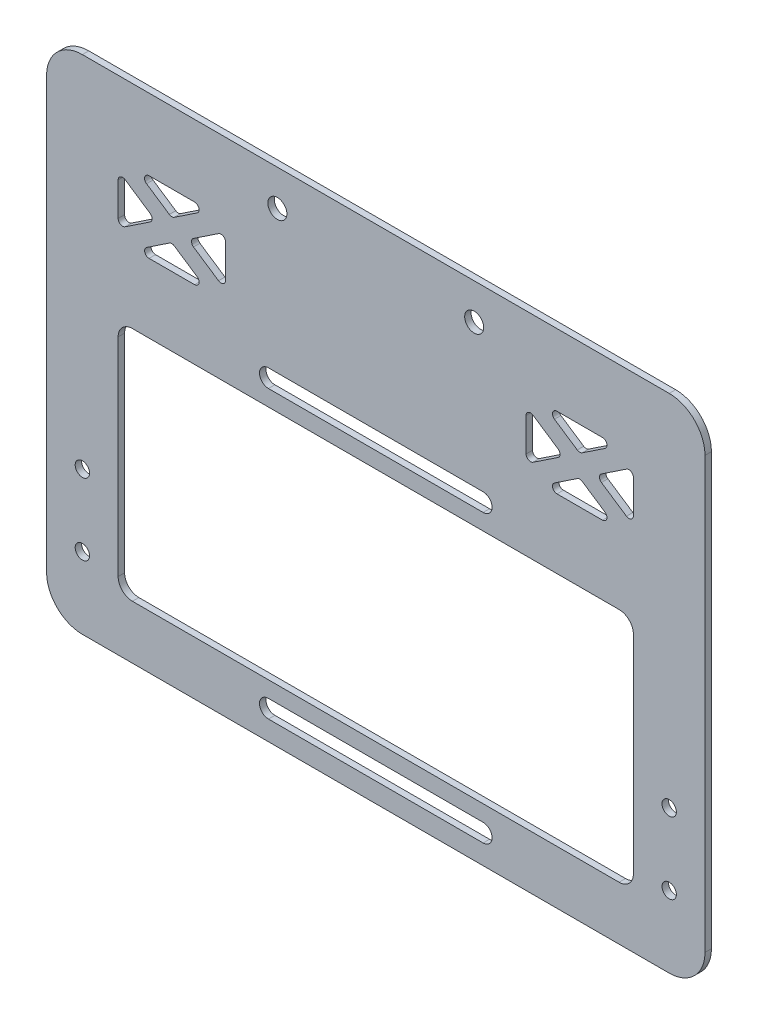
from build123d import *

# Parameters (mm, degrees)
SKETCH1_W               = 233.68
SKETCH1_H               = 178.200406036
BOSS_EXTRUDE1_DEPTH     = 2.286
CUT_EXTRUDE1_DEPTH      = 147.95461059
F_1_4_CLEARANCE_HOLE2_D = 6.7564
FILLET1_R               = 12.7
SKETCH9_R               = 2.5527
CUT_EXTRUDE2_DEPTH      = 147.95461059
CUT_EXTRUDE3_DEPTH      = 147.95461059
FILLET2_R               = 1.5875


with BuildPart() as part:
    # Sketch1 → Boss-Extrude1 (new body)
    with BuildSketch(Plane.XY):
        Rectangle(SKETCH1_W, SKETCH1_H)
        with BuildLine():
            Line((-86.36, 13.769796982), (86.36, 13.769796982))
            ThreePointArc((86.36, 13.769796982), (89.952102448, 12.281899431), (91.44, 8.689796982))
            Line((91.44, 8.689796982), (91.44, -64.970203018))
            ThreePointArc((91.44, -64.970203018), (89.952102448, -68.562305466), (86.36, -70.050203018))
            Line((86.36, -70.050203018), (-86.36, -70.050203018))
            ThreePointArc((-86.36, -70.050203018), (-89.952102448, -68.562305466), (-91.44, -64.970203018))
            Line((-91.44, -64.970203018), (-91.44, 8.689796982))
            ThreePointArc((-91.44, 8.689796982), (-89.952102448, 12.281899431), (-86.36, 13.769796982))
        make_face(mode=Mode.SUBTRACT)
    extrude(amount=BOSS_EXTRUDE1_DEPTH)

    # Sketch2 → Cut-Extrude1 (cut, through all)
    with BuildSketch(Plane.XY.offset(2.286)):
        with BuildLine():
            Line((38.1, 19.484796982), (-38.1, 19.484796982))
            ThreePointArc((-38.1, 19.484796982), (-41.275, 22.659796982), (-38.1, 25.834796982))
            Line((-38.1, 25.834796982), (38.1, 25.834796982))
            ThreePointArc((38.1, 25.834796982), (41.275, 22.659796982), (38.1, 19.484796982))
        make_face()
        with BuildLine():
            Line((38.1, -75.765203018), (-38.1, -75.765203018))
            ThreePointArc((-38.1, -75.765203018), (-41.275, -78.940203018), (-38.1, -82.115203018))
            Line((-38.1, -82.115203018), (38.1, -82.115203018))
            ThreePointArc((38.1, -82.115203018), (41.275, -78.940203018), (38.1, -75.765203018))
        make_face()
    extrude(amount=-CUT_EXTRUDE1_DEPTH, mode=Mode.SUBTRACT)

    # 1/4 Clearance Hole2 (through all)
    with Locations(Plane.XY.offset(2.286)):
        with Locations((-34.925, 76.400203018), (34.925, 76.400203018)):
            Hole(F_1_4_CLEARANCE_HOLE2_D / 2)

    # Fillet1
    fillet1_edges = [part.edges().sort_by_distance(p)[0] for p in [
        (-116.84, 89.100203018, 1.143),
        (116.84, 89.100203018, 1.143),
        (-116.84, -89.100203018, 1.143),
        (116.84, -89.100203018, 1.143),
    ]]
    fillet(fillet1_edges, radius=FILLET1_R)

    # Sketch9 → Cut-Extrude2 (cut, through all)
    with BuildSketch(Plane.XY.offset(2.286)):
        with Locations((-104.14, -63.700203018)):
            Circle(SKETCH9_R)
        with Locations((104.14, -63.700203018)):
            Circle(SKETCH9_R)
        with Locations((104.14, -38.300203018)):
            Circle(SKETCH9_R)
        with Locations((-104.14, -38.300203018)):
            Circle(SKETCH9_R)
    extrude(amount=-CUT_EXTRUDE2_DEPTH, mode=Mode.SUBTRACT)

    # Sketch10 → Cut-Extrude3 (cut, through all)
    with BuildSketch(Plane.XY.offset(2.286)):
        Polygon((-59.06381265, 63.700203018), (-85.71618735, 63.700203018), (-72.39, 54.816078117), align=None)
        Polygon((-78.11381265, 51.000203018), (-91.44, 59.884327918), (-91.44, 42.116078117), align=None)
        Polygon((-53.34, 59.884327918), (-66.66618735, 51.000203018), (-53.34, 42.116078117), align=None)
        Polygon((-59.06381265, 38.300203018), (-72.39, 47.184327918), (-85.71618735, 38.300203018), align=None)
        Polygon((85.71618735, 63.700203018), (59.06381265, 63.700203018), (72.39, 54.816078117), align=None)
        Polygon((66.66618735, 51.000203018), (53.34, 59.884327918), (53.34, 42.116078117), align=None)
        Polygon((91.44, 59.884327918), (78.11381265, 51.000203018), (91.44, 42.116078117), align=None)
        Polygon((85.71618735, 38.300203018), (72.39, 47.184327918), (59.06381265, 38.300203018), align=None)
    extrude(amount=-CUT_EXTRUDE3_DEPTH, mode=Mode.SUBTRACT)

    # Fillet2
    fillet2_edges = [part.edges().sort_by_distance(p)[0] for p in [
        (91.44, 59.884327918, 1.143),
        (91.44, 42.116078117, 1.143),
        (78.11381265, 51.000203018, 1.143),
        (85.71618735, 63.700203018, 1.143),
        (59.06381265, 63.700203018, 1.143),
        (72.39, 54.816078117, 1.143),
        (66.66618735, 51.000203018, 1.143),
        (53.34, 59.884327918, 1.143),
        (53.34, 42.116078117, 1.143),
        (85.71618735, 38.300203018, 1.143),
        (72.39, 47.184327918, 1.143),
        (59.06381265, 38.300203018, 1.143),
        (-78.11381265, 51.000203018, 1.143),
        (-91.44, 59.884327918, 1.143),
        (-91.44, 42.116078117, 1.143),
        (-59.06381265, 63.700203018, 1.143),
        (-85.71618735, 63.700203018, 1.143),
        (-72.39, 54.816078117, 1.143),
        (-53.34, 59.884327918, 1.143),
        (-53.34, 42.116078117, 1.143),
        (-66.66618735, 51.000203018, 1.143),
        (-72.39, 47.184327918, 1.143),
        (-59.06381265, 38.300203018, 1.143),
        (-85.71618735, 38.300203018, 1.143),
    ]]
    fillet(fillet2_edges, radius=FILLET2_R)


solid = part.part
